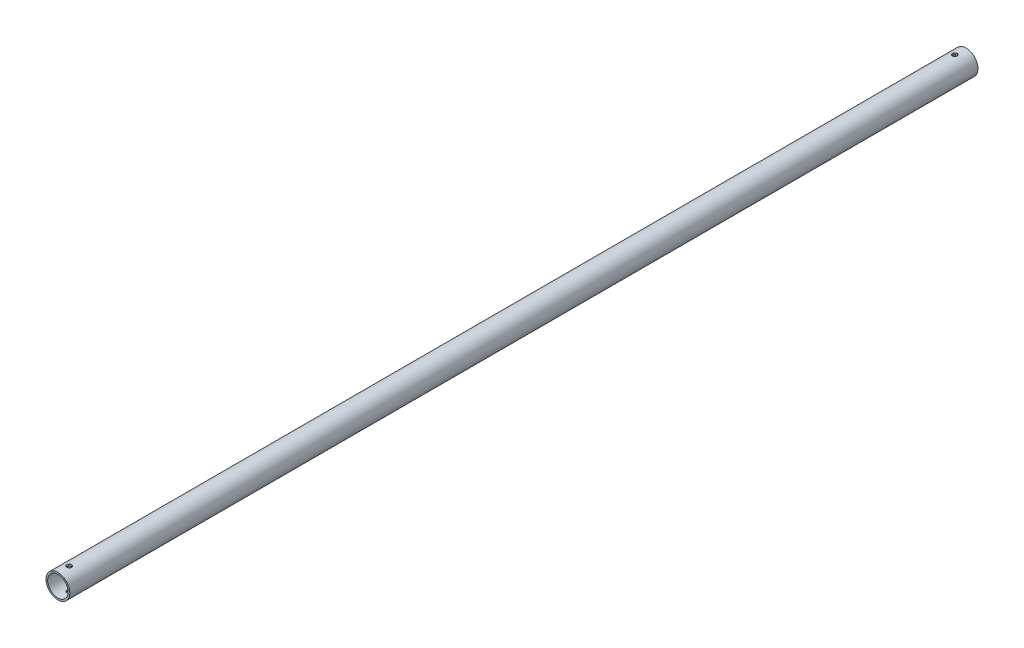
from build123d import *

# Parameters (mm, degrees)
SKETCH1_R           = 6.35
SKETCH1_R_2         = 5.461
BOSS_EXTRUDE1_DEPTH = 242
SKETCH2_R           = 1.25
CUT_EXTRUDE1_DEPTH  = 243.166564579


with BuildPart() as part:
    # Sketch1 → Boss-Extrude1 (new, symmetric)
    with BuildSketch(Plane.XY):
        Circle(SKETCH1_R)
        Circle(SKETCH1_R_2, mode=Mode.SUBTRACT)
    extrude(amount=BOSS_EXTRUDE1_DEPTH, both=True)

    # Sketch2 → Cut-Extrude1 (cut, symmetric)
    with BuildSketch(Plane(origin=(0, 0, 0), x_dir=(1, 0, 0), z_dir=(0, 1, 0))):
        with Locations((0, 236)):
            Circle(SKETCH2_R)
    cut_extrude1 = extrude(amount=CUT_EXTRUDE1_DEPTH, both=True, mode=Mode.SUBTRACT)

    # Mirror1: Cut-Extrude1 across plane
    add(cut_extrude1.mirror(Plane.XY), mode=Mode.SUBTRACT)


solid = part.part
